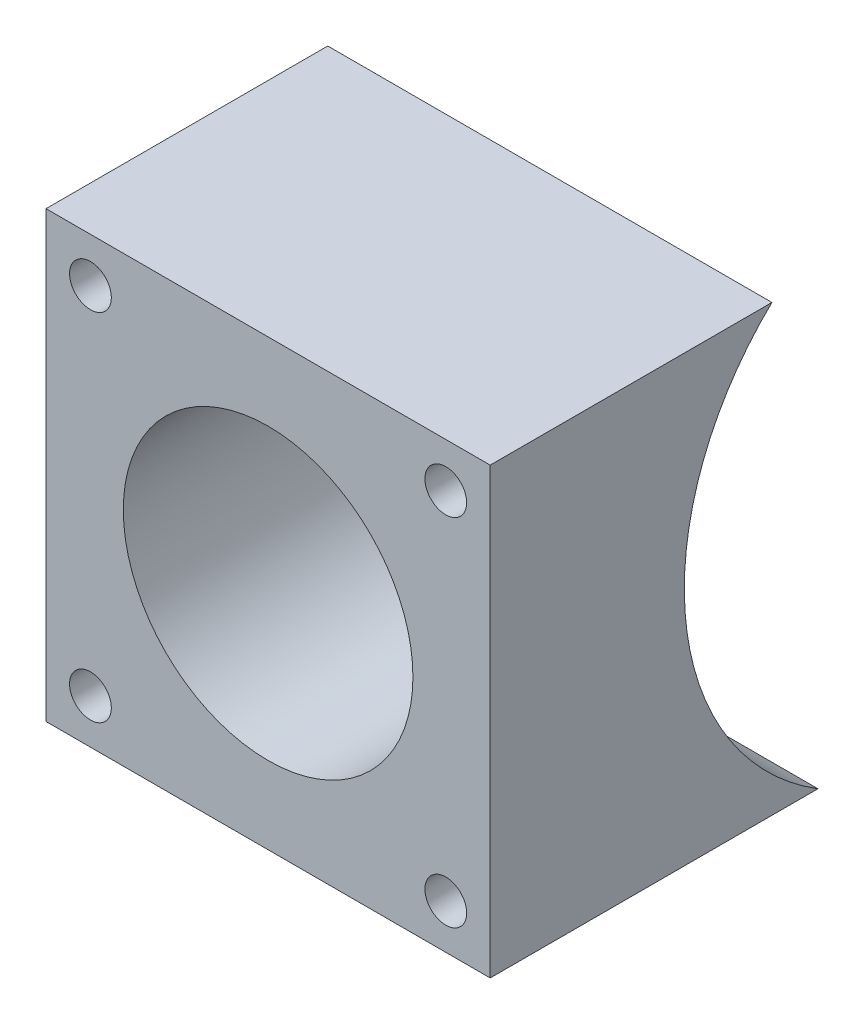
from build123d import *

# Parameters (mm, degrees)
SKETCH1_W               = 50
SKETCH1_H               = 50
SKETCH1_R               = 16.3
SKETCH1_R_2             = 2.35
BOSS_EXTRUDE1_DEPTH     = 53.6
CUT_EXTRUDE1_DEPTH      = 66.015075175
CUT_EXTRUDE1_DEPTH_BACK = 66.015075175
SKETCH2_R               = 31.75


with BuildPart() as part:
    # Sketch1 → Boss-Extrude1 (new body)
    with BuildSketch(Plane.XY):
        with Locations((0, -2)):
            Rectangle(SKETCH1_W, SKETCH1_H)
        with Locations((0, -2)):
            Circle(SKETCH1_R, mode=Mode.SUBTRACT)
        with Locations((-20, 18)):
            Circle(SKETCH1_R_2, mode=Mode.SUBTRACT)
        with Locations((20, 18)):
            Circle(SKETCH1_R_2, mode=Mode.SUBTRACT)
        with Locations((20, -22)):
            Circle(SKETCH1_R_2, mode=Mode.SUBTRACT)
        with Locations((-20, -22)):
            Circle(SKETCH1_R_2, mode=Mode.SUBTRACT)
    extrude(amount=BOSS_EXTRUDE1_DEPTH)

    # Sketch2 → Cut-Extrude1 (cut, two sides: drawn at the far end of the back side and taken through both)
    with BuildSketch(Plane(origin=(0, 0, 0), x_dir=(0, 0, -1), z_dir=(1, 0, 0)).offset(-CUT_EXTRUDE1_DEPTH_BACK)):
        Circle(SKETCH2_R)
    extrude(amount=CUT_EXTRUDE1_DEPTH + CUT_EXTRUDE1_DEPTH_BACK, mode=Mode.SUBTRACT)


solid = part.part
